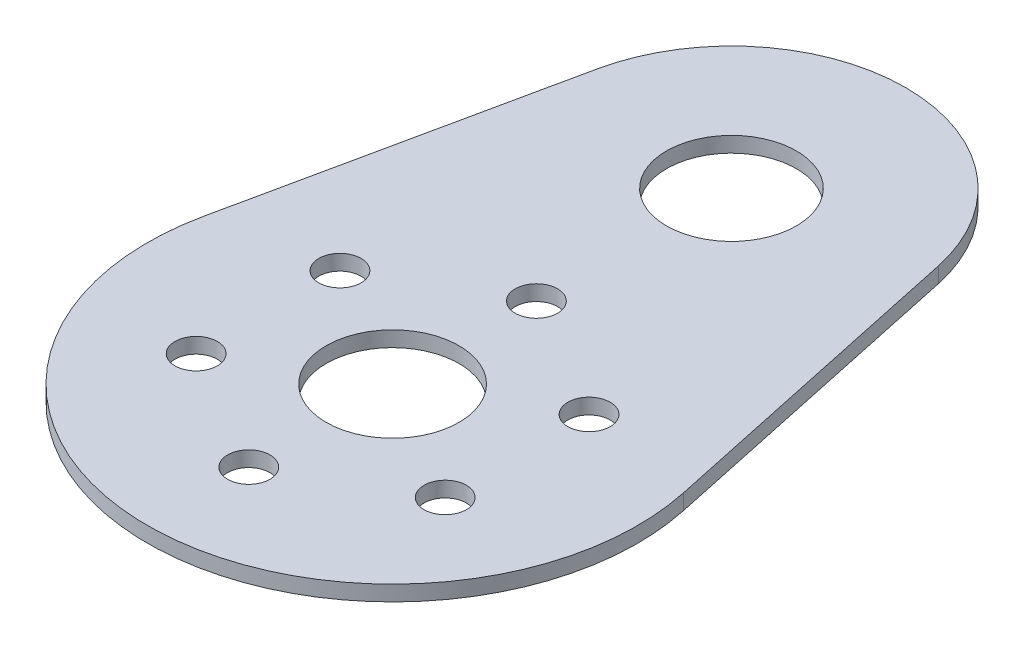
from build123d import *

# Parameters (mm, degrees)
SKETCH1_R           = 10.935851228
SKETCH1_R_2         = 3.48505149
SKETCH1_R_3         = 10.695502849
BOSS_EXTRUDE1_DEPTH = 2.54


with BuildPart() as part:
    # Sketch1 → Boss-Extrude1 (new body)
    with BuildSketch(Plane(origin=(0, 0, 0), x_dir=(1, 0, 0), z_dir=(0, 1, 0))):
        with BuildLine():
            Line((-28.082812294, 61.774443458), (-39.460298719, 8.413649402))
            ThreePointArc((-39.460298719, 8.413649402), (0, -40.347300669), (39.460298719, 8.413649402))
            Line((39.460298719, 8.413649402), (28.082812294, 61.774443458))
            ThreePointArc((28.082812294, 61.774443458), (0, 84.500747199), (-28.082812294, 61.774443458))
        make_face()
        Circle(SKETCH1_R, mode=Mode.SUBTRACT)
        with Locations((0, 23.674315295)):
            Circle(SKETCH1_R_2, mode=Mode.SUBTRACT)
        with Locations((20.502558462, 11.837157647)):
            Circle(SKETCH1_R_2, mode=Mode.SUBTRACT)
        with Locations((20.502558462, -11.837157647)):
            Circle(SKETCH1_R_2, mode=Mode.SUBTRACT)
        with Locations((0, -23.674315295)):
            Circle(SKETCH1_R_2, mode=Mode.SUBTRACT)
        with Locations((-20.502558462, -11.837157647)):
            Circle(SKETCH1_R_2, mode=Mode.SUBTRACT)
        with Locations((-20.502558462, 11.837157647)):
            Circle(SKETCH1_R_2, mode=Mode.SUBTRACT)
        with Locations((0, 55.786679946)):
            Circle(SKETCH1_R_3, mode=Mode.SUBTRACT)
    extrude(amount=BOSS_EXTRUDE1_DEPTH)


solid = part.part
